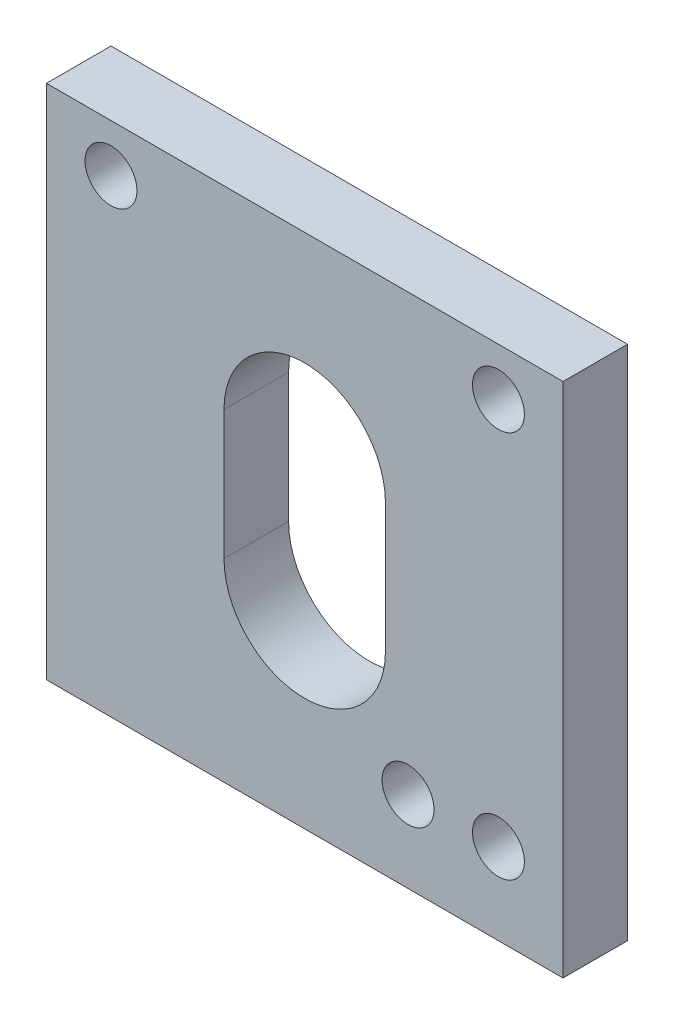
from build123d import *

# Parameters (mm, degrees)
SKETCH1_W           = 50.8
SKETCH1_H           = 50.8
SKETCH1_R           = 2.5527
BOSS_EXTRUDE1_DEPTH = 6.35


with BuildPart() as part:
    # Sketch1 → Boss-Extrude1 (new body)
    with BuildSketch(Plane.XY):
        Rectangle(SKETCH1_W, SKETCH1_H)
        with Locations((-19.05, 20.701)):
            Circle(SKETCH1_R, mode=Mode.SUBTRACT)
        with Locations((19.05, 20.701)):
            Circle(SKETCH1_R, mode=Mode.SUBTRACT)
        with Locations((19.05, -17.399)):
            Circle(SKETCH1_R, mode=Mode.SUBTRACT)
        with Locations((10.16, -17.399)):
            Circle(SKETCH1_R, mode=Mode.SUBTRACT)
        with BuildLine():
            Line((-7.9375, -6.35), (-7.9375, 6.35))
            ThreePointArc((-7.9375, 6.35), (0, 14.2875), (7.9375, 6.35))
            Line((7.9375, 6.35), (7.9375, -6.35))
            ThreePointArc((7.9375, -6.35), (0, -14.2875), (-7.9375, -6.35))
        make_face(mode=Mode.SUBTRACT)
    extrude(amount=BOSS_EXTRUDE1_DEPTH)


solid = part.part
